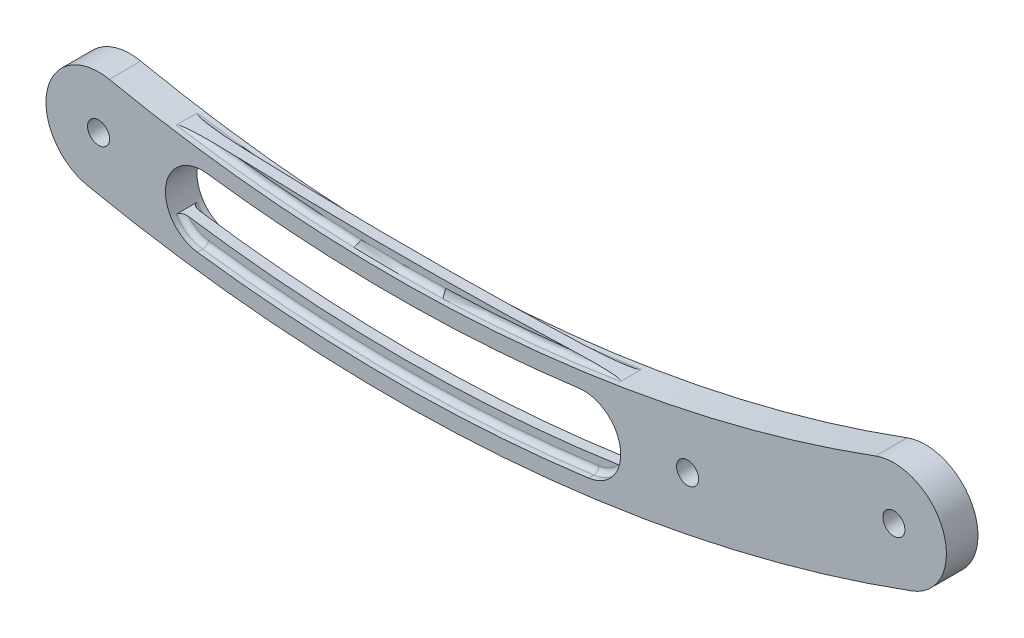
from build123d import *

# Parameters (mm, degrees)
CROQUIS1_R              = 2.1
SALIENTE_EXTRUIR1_DEPTH = 6
SALIENTE_EXTRUIR3_DEPTH = 1
REDONDEO2_R             = 1


with BuildPart() as part:
    # Croquis1 → Saliente-Extruir1 (new body)
    with BuildSketch(Plane.XY):
        with BuildLine():
            ThreePointArc((-114.035873061, -9.790567955), (-34.858360528, -14.975714339), (42.681169488, 1.864283248))
            ThreePointArc((42.681169488, 1.864283248), (48.601198063, 14.707696411), (35.7577849, 20.627724986))
            ThreePointArc((35.7577849, 20.627724986), (-36.341639472, 4.969206908), (-109.964126939, 9.790567955))
            ThreePointArc((-109.964126939, 9.790567955), (-121.790567955, 2.035873061), (-114.035873061, -9.790567955))
        make_face()
        Circle(CROQUIS1_R, mode=Mode.SUBTRACT)
        with Locations((39.219477194, 11.246004117)):
            Circle(CROQUIS1_R, mode=Mode.SUBTRACT)
        with Locations((-112, 0)):
            Circle(CROQUIS1_R, mode=Mode.SUBTRACT)
        with BuildLine():
            ThreePointArc((-93.207145152, -10.296017287), (-56, -12.760769052), (-18.792854848, -10.296017287))
            ThreePointArc((-18.792854848, -10.296017287), (-12.777386897, -2.433820054), (-20.63958413, 3.581647897))
            ThreePointArc((-20.63958413, 3.581647897), (-56, 1.239230948), (-91.36041587, 3.581647897))
            ThreePointArc((-91.36041587, 3.581647897), (-99.222613103, -2.433820054), (-93.207145152, -10.296017287))
        make_face(mode=Mode.SUBTRACT)
    extrude(amount=SALIENTE_EXTRUIR1_DEPTH)

    # Croquis3 → Saliente-Extruir3 (add, symmetric)
    with BuildSketch(Plane.XY.offset(3)):
        with BuildLine():
            ThreePointArc((-98.228577232, -7.053046158), (-96.081427883, -9.237480134), (-93.207145152, -10.296017287))
            ThreePointArc((-93.207145152, -10.296017287), (-56, -12.760769052), (-18.792854848, -10.296017287))
            ThreePointArc((-18.792854848, -10.296017287), (-15.918572117, -9.237480134), (-13.771422768, -7.053046158))
            ThreePointArc((-13.771422768, -7.053046158), (-56, -10.260769052), (-98.228577232, -7.053046158))
        make_face()
        with BuildLine():
            ThreePointArc((-98.228577232, 7.624636675), (-56, 6.557109307), (-13.771422768, 7.624636675))
            ThreePointArc((-13.771422768, 7.624636675), (-56, 4.239230948), (-98.228577232, 7.624636675))
        make_face()
    extrude(amount=SALIENTE_EXTRUIR3_DEPTH, both=True)

    # Redondeo2
    redondeo2_edges = [part.edges().sort_by_distance(p)[0] for p in [
        (-96.081427883, -9.237480134, 2),
        (-15.918572117, -9.237480134, 2),
        (-96.081427883, -9.237480134, 4),
        (-15.918572117, -9.237480134, 4),
        (-56, -12.760769052, 2),
        (-56, -12.760769052, 4),
        (-56, 4.239230948, 2),
        (-56, 4.239230948, 4),
    ]]
    fillet(redondeo2_edges, radius=REDONDEO2_R)


solid = part.part
